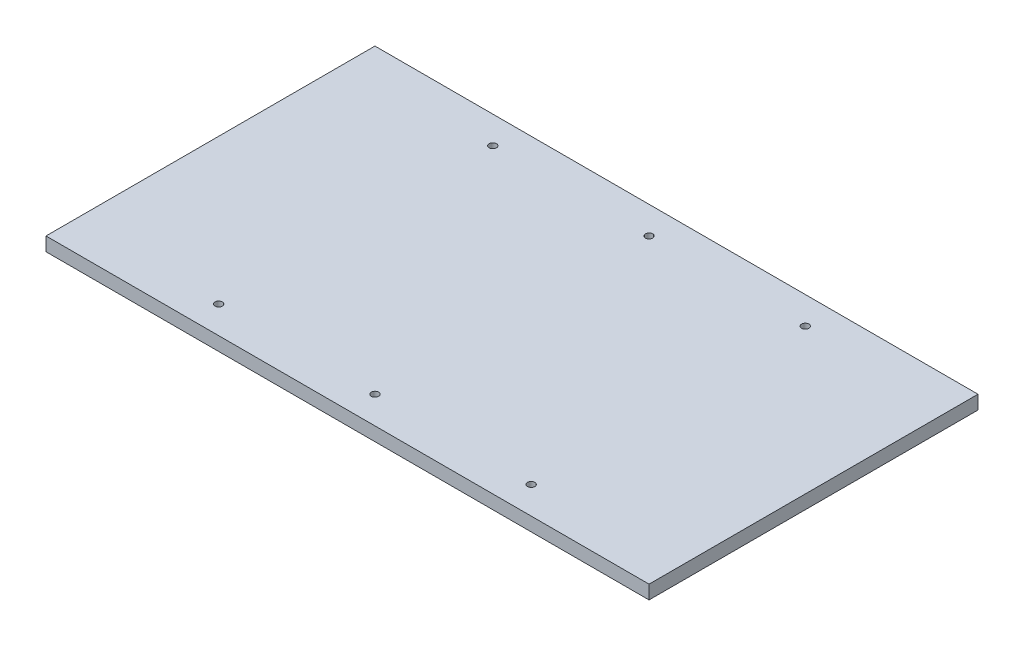
from build123d import *

# Parameters (mm, degrees)
SKETCH1_W           = 279.4
SKETCH1_H           = 152.4
SKETCH1_R           = 1.7
BOSS_EXTRUDE1_DEPTH = 6.35


with BuildPart() as part:
    # Sketch1 → Boss-Extrude1 (new body)
    with BuildSketch(Plane(origin=(0, 0, 0), x_dir=(1, 0, 0), z_dir=(0, 1, 0))):
        Rectangle(SKETCH1_W, SKETCH1_H)
        with Locations((-72.39, 63.5)):
            Circle(SKETCH1_R, mode=Mode.SUBTRACT)
        with Locations((72.39, -63.5)):
            Circle(SKETCH1_R, mode=Mode.SUBTRACT)
        with Locations((0, 63.5)):
            Circle(SKETCH1_R, mode=Mode.SUBTRACT)
        with Locations((72.39, 63.5)):
            Circle(SKETCH1_R, mode=Mode.SUBTRACT)
        with Locations((0, -63.5)):
            Circle(SKETCH1_R, mode=Mode.SUBTRACT)
        with Locations((-72.39, -63.5)):
            Circle(SKETCH1_R, mode=Mode.SUBTRACT)
    extrude(amount=BOSS_EXTRUDE1_DEPTH)


solid = part.part
